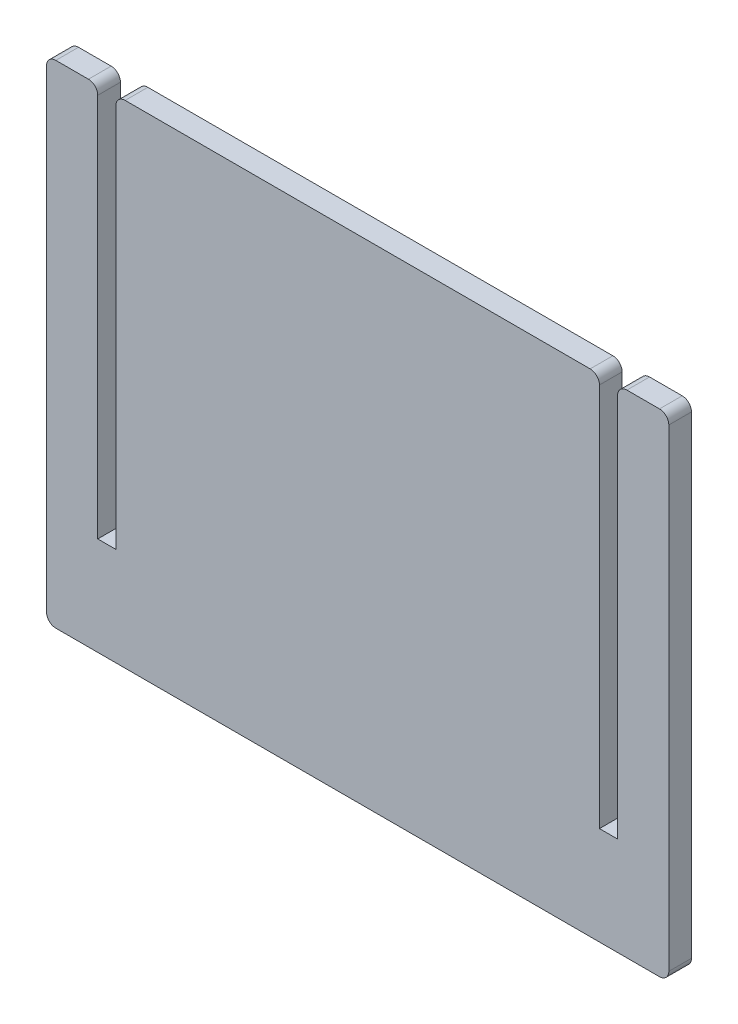
from build123d import *

# Parameters (mm, degrees)
BOSS_EXTRUDE1_DEPTH = 3.175
FILLET1_R           = 1.27
SHELL1_START        = -0.1778
SHELL1_OUTLINE_W    = 80.9244
SHELL1_OUTLINE_H    = 3.5306
SHELL1_DEPTH        = 0.1778
SHELL1_START_2      = 14.942805851
SHELL1_2_OUTLINE_W  = 2.8194
SHELL1_2_OUTLINE_H  = 3.5306
SHELL1_2_DEPTH      = 0.1778
SHELL1_3_DEPTH      = 3.175
SHELL1_4_DEPTH      = 0.1778
SHELL1_START_3      = 3.175
SHELL1_5_DEPTH      = 0.1778
SHELL1_6_DEPTH      = 3.5306


with BuildPart() as part:
    # Sketch1 → Boss-Extrude1 (new body)
    with BuildSketch(Plane.XY):
        Polygon((48.26, 0), (48.26, 76.2), (10.795, 76.2), (10.795, 14.942805851), (7.62, 14.942805851), (7.62, 76.2), (0, 76.2), (0, 0), align=None)
        Polygon((85.725, 76.2), (48.26, 76.2), (48.26, 0), (96.52, 0), (96.52, 76.2), (88.9, 76.2), (88.9, 14.942805851), (85.725, 14.942805851), align=None)
    extrude(amount=BOSS_EXTRUDE1_DEPTH)

    # Fillet1
    fillet1_edges = [part.edges().sort_by_distance(p)[0] for p in [
        (0, 0, 1.5875),
        (0, 76.2, 1.5875),
        (7.62, 76.2, 1.5875),
        (10.795, 76.2, 1.5875),
        (85.725, 76.2, 1.5875),
        (88.9, 76.2, 1.5875),
        (96.52, 76.2, 1.5875),
        (96.52, 0, 1.5875),
    ]]
    fillet(fillet1_edges, radius=FILLET1_R)

    # Shell1: read off the stored shape, not the designer's step
    # Shell1 outline → Shell1 (add)
    with BuildSketch(Plane(origin=(0, 0, 0), x_dir=(1, 0, 0), z_dir=(0, 1, 0)).offset(SHELL1_START)):
        with Locations((48.26, -1.5875)):
            Rectangle(SHELL1_OUTLINE_W, SHELL1_OUTLINE_H)
    extrude(amount=SHELL1_DEPTH)

    # Shell1 2 outline → Shell1 2 (add)
    with BuildSketch(Plane(origin=(0, 0, 0), x_dir=(1, 0, 0), z_dir=(0, 1, 0)).offset(SHELL1_START_2)):
        with Locations((87.3125, -1.5875)):
            Rectangle(SHELL1_2_OUTLINE_W, SHELL1_2_OUTLINE_H)
        with Locations((9.2075, -1.5875)):
            Rectangle(SHELL1_2_OUTLINE_W, SHELL1_2_OUTLINE_H)
    extrude(amount=SHELL1_2_DEPTH)

    # Shell1 3 outline → Shell1 3 (cut)
    with BuildSketch(Plane.XY):
        with BuildLine():
            Line((1.27, 0), (95.25, 0))
            ThreePointArc((95.25, 0), (96.148025612, 0.371974388), (96.52, 1.27))
            Line((96.52, 1.27), (96.52, 74.93))
            ThreePointArc((96.52, 74.93), (96.148025612, 75.828025612), (95.25, 76.2))
            Line((95.25, 76.2), (90.17, 76.2))
            ThreePointArc((90.17, 76.2), (89.271974388, 75.828025612), (88.9, 74.93))
            Line((88.9, 74.93), (88.9, 14.942805851))
            Line((88.9, 14.942805851), (85.725, 14.942805851))
            Line((85.725, 14.942805851), (85.725, 74.93))
            ThreePointArc((85.725, 74.93), (85.353025612, 75.828025612), (84.455, 76.2))
            Line((84.455, 76.2), (12.065, 76.2))
            ThreePointArc((12.065, 76.2), (11.166974388, 75.828025612), (10.795, 74.93))
            Line((10.795, 74.93), (10.795, 14.942805851))
            Line((10.795, 14.942805851), (7.62, 14.942805851))
            Line((7.62, 14.942805851), (7.62, 74.93))
            ThreePointArc((7.62, 74.93), (7.248025612, 75.828025612), (6.35, 76.2))
            Line((6.35, 76.2), (1.27, 76.2))
            ThreePointArc((1.27, 76.2), (0.371974388, 75.828025612), (0, 74.93))
            Line((0, 74.93), (0, 1.27))
            ThreePointArc((0, 1.27), (0.371974388, 0.371974388), (1.27, 0))
        make_face()
    extrude(amount=SHELL1_3_DEPTH, mode=Mode.SUBTRACT)

    # Shell1 4 outline → Shell1 4 (add)
    with BuildSketch(Plane.XY.offset(SHELL1_START)):
        with BuildLine():
            Line((96.6978, 1.27), (96.6978, 74.93))
            ThreePointArc((96.6978, 74.93), (96.273749198, 75.953749198), (95.25, 76.3778))
            Line((95.25, 76.3778), (90.17, 76.3778))
            ThreePointArc((90.17, 76.3778), (89.146250802, 75.953749198), (88.7222, 74.93))
            Line((88.7222, 74.93), (88.7222, 14.942805851))
            Line((88.7222, 14.942805851), (85.9028, 14.942805851))
            Line((85.9028, 14.942805851), (85.9028, 74.93))
            ThreePointArc((85.9028, 74.93), (85.478749198, 75.953749198), (84.455, 76.3778))
            Line((84.455, 76.3778), (12.065, 76.3778))
            ThreePointArc((12.065, 76.3778), (11.041250802, 75.953749198), (10.6172, 74.93))
            Line((10.6172, 74.93), (10.6172, 14.942805851))
            Line((10.6172, 14.942805851), (7.7978, 14.942805851))
            Line((7.7978, 14.942805851), (7.7978, 74.93))
            ThreePointArc((7.7978, 74.93), (7.373749198, 75.953749198), (6.35, 76.3778))
            Line((6.35, 76.3778), (1.27, 76.3778))
            ThreePointArc((1.27, 76.3778), (0.246250802, 75.953749198), (-0.1778, 74.93))
            Line((-0.1778, 74.93), (-0.1778, 1.27))
            ThreePointArc((-0.1778, 1.27), (0.246250802, 0.246250802), (1.27, -0.1778))
            Line((1.27, -0.1778), (7.7978, -0.1778))
            Line((7.7978, -0.1778), (7.7978, 0))
            Line((7.7978, 0), (88.7222, 0))
            Line((88.7222, 0), (88.7222, -0.1778))
            Line((88.7222, -0.1778), (95.25, -0.1778))
            ThreePointArc((95.25, -0.1778), (96.273749198, 0.246250802), (96.6978, 1.27))
        make_face()
    extrude(amount=SHELL1_4_DEPTH)

    # Shell1 5 outline → Shell1 5 (add)
    with BuildSketch(Plane.XY.offset(SHELL1_START_3)):
        with BuildLine():
            Line((96.6978, 1.27), (96.6978, 74.93))
            ThreePointArc((96.6978, 74.93), (96.273749198, 75.953749198), (95.25, 76.3778))
            Line((95.25, 76.3778), (90.17, 76.3778))
            ThreePointArc((90.17, 76.3778), (89.146250802, 75.953749198), (88.7222, 74.93))
            Line((88.7222, 74.93), (88.7222, 14.942805851))
            Line((88.7222, 14.942805851), (85.9028, 14.942805851))
            Line((85.9028, 14.942805851), (85.9028, 74.93))
            ThreePointArc((85.9028, 74.93), (85.478749198, 75.953749198), (84.455, 76.3778))
            Line((84.455, 76.3778), (12.065, 76.3778))
            ThreePointArc((12.065, 76.3778), (11.041250802, 75.953749198), (10.6172, 74.93))
            Line((10.6172, 74.93), (10.6172, 14.942805851))
            Line((10.6172, 14.942805851), (7.7978, 14.942805851))
            Line((7.7978, 14.942805851), (7.7978, 74.93))
            ThreePointArc((7.7978, 74.93), (7.373749198, 75.953749198), (6.35, 76.3778))
            Line((6.35, 76.3778), (1.27, 76.3778))
            ThreePointArc((1.27, 76.3778), (0.246250802, 75.953749198), (-0.1778, 74.93))
            Line((-0.1778, 74.93), (-0.1778, 1.27))
            ThreePointArc((-0.1778, 1.27), (0.246250802, 0.246250802), (1.27, -0.1778))
            Line((1.27, -0.1778), (7.7978, -0.1778))
            Line((7.7978, -0.1778), (7.7978, 0))
            Line((7.7978, 0), (88.7222, 0))
            Line((88.7222, 0), (88.7222, -0.1778))
            Line((88.7222, -0.1778), (95.25, -0.1778))
            ThreePointArc((95.25, -0.1778), (96.273749198, 0.246250802), (96.6978, 1.27))
        make_face()
    extrude(amount=SHELL1_5_DEPTH)

    # Shell1 6 outline → Shell1 6 (add)
    with BuildSketch(Plane.XY.offset(SHELL1_START)):
        with BuildLine():
            Line((96.6978, 1.27), (96.6978, 74.93))
            ThreePointArc((96.6978, 74.93), (96.273749198, 75.953749198), (95.25, 76.3778))
            Line((95.25, 76.3778), (90.17, 76.3778))
            ThreePointArc((90.17, 76.3778), (89.146250802, 75.953749198), (88.7222, 74.93))
            Line((88.7222, 74.93), (88.7222, 14.942805851))
            Line((88.7222, 14.942805851), (88.9, 14.942805851))
            Line((88.9, 14.942805851), (88.9, 74.93))
            ThreePointArc((88.9, 74.93), (89.271974388, 75.828025612), (90.17, 76.2))
            Line((90.17, 76.2), (95.25, 76.2))
            ThreePointArc((95.25, 76.2), (96.148025612, 75.828025612), (96.52, 74.93))
            Line((96.52, 74.93), (96.52, 1.27))
            ThreePointArc((96.52, 1.27), (96.148025612, 0.371974388), (95.25, 0))
            Line((95.25, 0), (88.7222, 0))
            Line((88.7222, 0), (88.7222, -0.1778))
            Line((88.7222, -0.1778), (95.25, -0.1778))
            ThreePointArc((95.25, -0.1778), (96.273749198, 0.246250802), (96.6978, 1.27))
        make_face()
        with BuildLine():
            Line((1.27, -0.1778), (7.7978, -0.1778))
            Line((7.7978, -0.1778), (7.7978, 0))
            Line((7.7978, 0), (1.27, 0))
            ThreePointArc((1.27, 0), (0.371974388, 0.371974388), (0, 1.27))
            Line((0, 1.27), (0, 74.93))
            ThreePointArc((0, 74.93), (0.371974388, 75.828025612), (1.27, 76.2))
            Line((1.27, 76.2), (6.35, 76.2))
            ThreePointArc((6.35, 76.2), (7.248025612, 75.828025612), (7.62, 74.93))
            Line((7.62, 74.93), (7.62, 14.942805851))
            Line((7.62, 14.942805851), (7.7978, 14.942805851))
            Line((7.7978, 14.942805851), (7.7978, 74.93))
            ThreePointArc((7.7978, 74.93), (7.373749198, 75.953749198), (6.35, 76.3778))
            Line((6.35, 76.3778), (1.27, 76.3778))
            ThreePointArc((1.27, 76.3778), (0.246250802, 75.953749198), (-0.1778, 74.93))
            Line((-0.1778, 74.93), (-0.1778, 1.27))
            ThreePointArc((-0.1778, 1.27), (0.246250802, 0.246250802), (1.27, -0.1778))
        make_face()
        with BuildLine():
            Line((85.725, 14.942805851), (85.9028, 14.942805851))
            Line((85.9028, 14.942805851), (85.9028, 74.93))
            ThreePointArc((85.9028, 74.93), (85.478749198, 75.953749198), (84.455, 76.3778))
            Line((84.455, 76.3778), (12.065, 76.3778))
            ThreePointArc((12.065, 76.3778), (11.041250802, 75.953749198), (10.6172, 74.93))
            Line((10.6172, 74.93), (10.6172, 14.942805851))
            Line((10.6172, 14.942805851), (10.795, 14.942805851))
            Line((10.795, 14.942805851), (10.795, 74.93))
            ThreePointArc((10.795, 74.93), (11.166974388, 75.828025612), (12.065, 76.2))
            Line((12.065, 76.2), (84.455, 76.2))
            ThreePointArc((84.455, 76.2), (85.353025612, 75.828025612), (85.725, 74.93))
            Line((85.725, 74.93), (85.725, 14.942805851))
        make_face()
    extrude(amount=SHELL1_6_DEPTH)


solid = part.part
